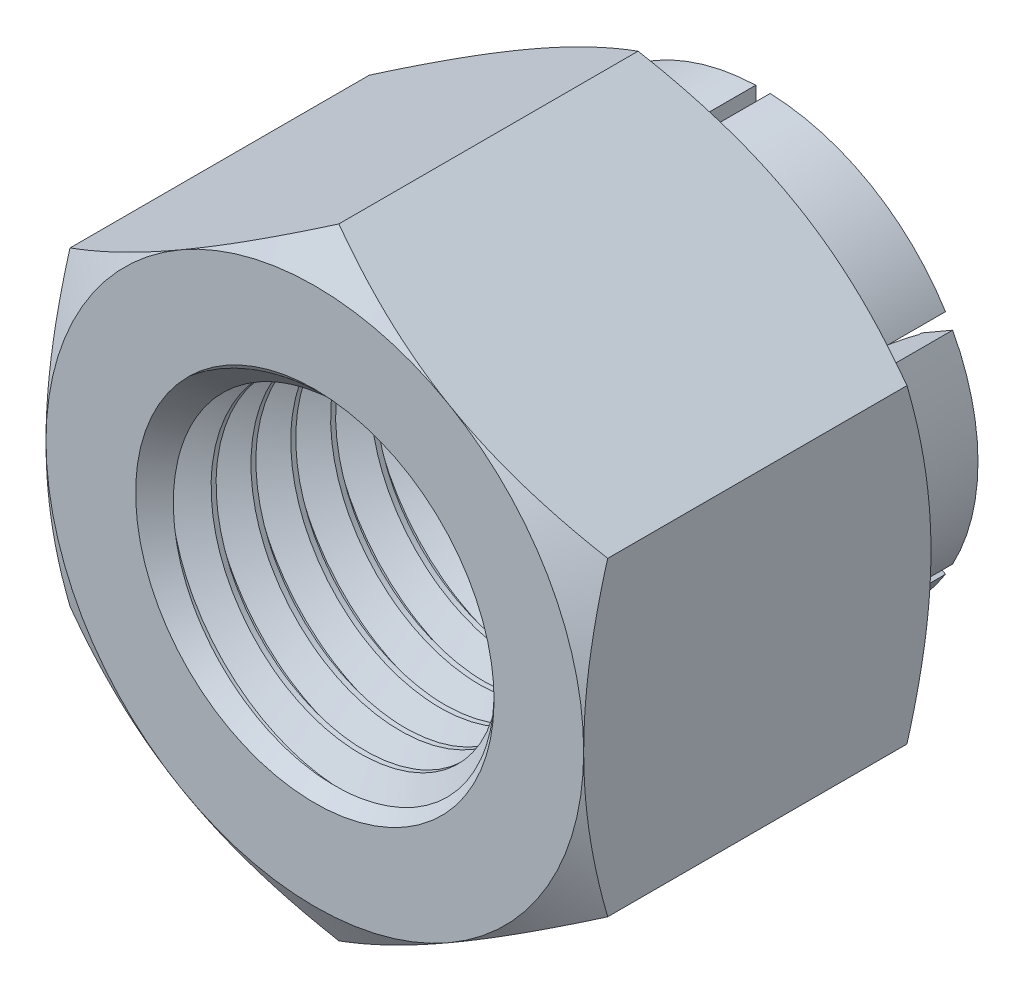
from build123d import *

# Parameters (mm, degrees)
EXTRUDE1_DEPTH          = 11.90625
SKETCH2_OUTSIDE_W       = 80.672
SKETCH2_OUTSIDE_H       = 82.882
SKETCH2_OUTSIDE_R       = 7.14375
CUT_EXTRUDE1_DEPTH      = 17.150423272
CUT_EXTRUDE1_DRAFT      = -60
SKETCH4_R               = 4.7625
CUT_EXTRUDE3_DEPTH      = 17.150423272
SKETCH12_OUTSIDE_W      = 21.26
SKETCH12_OUTSIDE_H      = 23.47
SKETCH12_OUTSIDE_R      = 5.715
CUT_EXTRUDE10_DEPTH     = 2.67890625
SKETCH15_W              = 0.381
SKETCH15_H              = 8.248891971
CUT_EXTRUDE_THIN2_DEPTH = 2.17090625
CIRPATTERN1_COUNT       = 6
SKETCH3_OUTSIDE_W       = 74.228
SKETCH3_OUTSIDE_H       = 76.438
SKETCH3_OUTSIDE_R       = 7.14375
CUT_EXTRUDE2_DEPTH      = 15.29060025
CUT_EXTRUDE2_DRAFT      = -60
SWEEP1_PITCH            = 1.058333333
CUT_EXTRUDE8_DEPTH      = 17.945996243
CUT_EXTRUDE9_DEPTH      = 17.150423346
SKETCH17_R              = 4.7725
SKETCH17_R_2            = 4.7625
BOSS_EXTRUDE1_DEPTH     = 0.1
SKETCH16_W              = 0.381
SKETCH16_H              = 8.248891971
CUT_EXTRUDE_THIN3_DEPTH = 2.17890625
CIRPATTERN14_COUNT      = 6


with BuildPart() as part:
    # Sketch1 → Extrude1 (new body)
    with BuildSketch(Plane.XY):
        Polygon((0, 8.248891971), (-7.14375, 4.124445986), (-7.14375, -4.124445986), (0, -8.248891971), (7.14375, -4.124445986), (7.14375, 4.124445986), align=None)
    extrude(amount=-EXTRUDE1_DEPTH)


with BuildPart() as cut_extrude1_tool:
    # Sketch2 outside → Cut-Extrude1 (with draft: the straight prism first)
    with BuildSketch(Plane.XY):
        Rectangle(SKETCH2_OUTSIDE_W, SKETCH2_OUTSIDE_H)
        Circle(SKETCH2_OUTSIDE_R, mode=Mode.SUBTRACT)
    extrude(amount=-CUT_EXTRUDE1_DEPTH)
    # Cut-Extrude1: the draft: its side faces are tilted about the plane it starts from
    cut_extrude1_sides = [cut_extrude1_tool.faces().sort_by_distance(p)[0] for p in [
        (0, -41.441, -8.575211636),
        (40.336, 0, -8.575211636),
        (0, 41.441, -8.575211636),
        (-40.336, 0, -8.575211636),
        (-7.14375, 0, -8.575211636),
    ]]
    draft(cut_extrude1_sides, Plane.XY, CUT_EXTRUDE1_DRAFT)


with BuildPart() as part_1:
    add(part.part)

    # Cut-Extrude1: cut by cut_extrude1_tool
    add(cut_extrude1_tool.part, mode=Mode.SUBTRACT)

    # Sketch4 → Cut-Extrude3 (cut, through all)
    with BuildSketch(Plane.XY):
        Circle(SKETCH4_R)
    extrude(amount=-CUT_EXTRUDE3_DEPTH, mode=Mode.SUBTRACT)

    # Sketch12 outside → Cut-Extrude10 (cut)
    with BuildSketch(Plane(origin=(0, 0, -11.90625), x_dir=(-1, 0, 0), z_dir=(0, 0, -1))):
        Rectangle(SKETCH12_OUTSIDE_W, SKETCH12_OUTSIDE_H)
        Circle(SKETCH12_OUTSIDE_R, mode=Mode.SUBTRACT)
    extrude(amount=-CUT_EXTRUDE10_DEPTH, mode=Mode.SUBTRACT)

    # Sketch15 → Cut-Extrude-Thin2 (cut)
    with BuildSketch(Plane(origin=(0, 0, -11.90625), x_dir=(-1, 0, 0), z_dir=(0, 0, -1))):
        with Locations((0, -4.124445986)):
            Rectangle(SKETCH15_W, SKETCH15_H)
    cut_extrude_thin2 = extrude(amount=-CUT_EXTRUDE_THIN2_DEPTH, mode=Mode.SUBTRACT)

    # CirPattern1: Cut-Extrude-Thin2 ×6 about axis
    cirpattern1_axis = Axis((0, 0, 0), (0, 0, 1))
    for i in range(1, CIRPATTERN1_COUNT):
        add(cut_extrude_thin2.rotate(cirpattern1_axis, i * 360 / CIRPATTERN1_COUNT), mode=Mode.SUBTRACT)


with BuildPart() as cut_extrude2_tool:
    # Sketch3 outside → Cut-Extrude2 (with draft: the straight prism first)
    with BuildSketch(Plane(origin=(0, 0, -9.22734375), x_dir=(-1, 0, 0), z_dir=(0, 0, -1))):
        Rectangle(SKETCH3_OUTSIDE_W, SKETCH3_OUTSIDE_H)
        Circle(SKETCH3_OUTSIDE_R, mode=Mode.SUBTRACT)
    extrude(amount=-CUT_EXTRUDE2_DEPTH)
    # Cut-Extrude2: the draft: its side faces are tilted about the plane it starts from
    cut_extrude2_sides = [cut_extrude2_tool.faces().sort_by_distance(p)[0] for p in [
        (0, -38.219, -1.582043625),
        (-37.114, 0, -1.582043625),
        (0, 38.219, -1.582043625),
        (37.114, 0, -1.582043625),
        (7.14375, 0, -1.582043625),
    ]]
    draft(cut_extrude2_sides, Plane(origin=(0, 0, -9.22734375), x_dir=(-1, 0, 0), z_dir=(0, 0, -1)), CUT_EXTRUDE2_DRAFT)


with BuildPart() as part_2:
    add(part_1.part)

    # Cut-Extrude2: cut by cut_extrude2_tool
    add(cut_extrude2_tool.part, mode=Mode.SUBTRACT)



with BuildPart() as body_2:
    # Sweep1: the profile of Sketch9 profile screwed along a right-hand helix of 12.25 turns, 6 arcs to a turn; built about Z, then put on its axis
    sweep1_z = Axis((0, 0, 0), (0, 0, 1))
    sweep1_corners = [(4.075092336, 0, -0.529166667), (4.075092336, 0, -0.396875), (4.7631, 0, 0.00034641), (4.7631, 0, -0.926388077)]
    with BuildLine(mode=Mode.PRIVATE) as sweep1_profile:
        Line(sweep1_corners[0], sweep1_corners[1])
        Line(sweep1_corners[1], sweep1_corners[2])
        Line(sweep1_corners[2], sweep1_corners[3])
        Line(sweep1_corners[3], sweep1_corners[0])
    sweep1_cap = Face(sweep1_profile.wire())
    sweep1_turn_angles = [0, 30, 60, 90, 120, 150, 180, 210, 240, 270, 300, 330, 360]
    sweep1_turn_weights = [1, 0.8660254037844387, 1, 0.8660254037844387, 1, 0.8660254037844387, 1, 0.8660254037844387, 1, 0.8660254037844387, 1, 0.8660254037844387, 1]
    sweep1_turn_rails = [Edge.make_bspline([Vector(p[0], p[1], 0).rotate(sweep1_z, sweep1_turn_angles[k]) / sweep1_turn_weights[k] + Vector(0, 0, p[2] + SWEEP1_PITCH * sweep1_turn_angles[k] / 360) for k in range(13)], [0, 0, 0, 1, 1, 2, 2, 3, 3, 4, 4, 5, 5, 6, 6, 6], 2, sweep1_turn_weights) for p in sweep1_corners]
    sweep1_turn_sides = [Face.make_surface_from_curves(sweep1_turn_rails[p[0]], sweep1_turn_rails[p[1]]) for p in [(0, 1), (1, 2), (2, 3), (3, 0)]]
    sweep1_last_angles = [4320, 4350, 4380, 4395, 4410]
    sweep1_last_weights = [1, 0.8660254037844387, 1, 0.9659258262890231, 1]
    sweep1_last_rails = [Edge.make_bspline([Vector(p[0], p[1], 0).rotate(sweep1_z, sweep1_last_angles[k]) / sweep1_last_weights[k] + Vector(0, 0, p[2] + SWEEP1_PITCH * sweep1_last_angles[k] / 360) for k in range(5)], [0, 0, 0, 1, 1, 2, 2, 2], 2, sweep1_last_weights) for p in sweep1_corners]
    sweep1_last_sides = [Face.make_surface_from_curves(sweep1_last_rails[p[0]], sweep1_last_rails[p[1]]) for p in [(0, 1), (1, 2), (2, 3), (3, 0)]]
    sweep1 = Plane(origin=(0, 0, 0), x_dir=(0, 1, 0), z_dir=(0, 0, -1)) * Solid(Shell([*[p.moved(Location((0, 0, SWEEP1_PITCH * i))) for i in range(12) for p in sweep1_turn_sides], *sweep1_last_sides, sweep1_cap, sweep1_cap.rotate(sweep1_z, 4410).moved(Location((0, 0, SWEEP1_PITCH * 4410 / 360)))]))
    add(sweep1)

    # Sketch10 → Cut-Extrude8 (cut, through all)
    with BuildSketch(Plane.XY):
        Polygon((0, 8.248891971), (-7.14375, 4.124445986), (-7.14375, -4.124445986), (0, -8.248891971), (7.14375, -4.124445986), (7.14375, 4.124445986), align=None)
    extrude(amount=CUT_EXTRUDE8_DEPTH, mode=Mode.SUBTRACT)

    # Sketch11 → Cut-Extrude9 (cut, through all)
    with BuildSketch(Plane(origin=(0, 0, -11.90625), x_dir=(-1, 0, 0), z_dir=(0, 0, -1))):
        Polygon((7.14375, 4.124445986), (0, 8.248891971), (-7.14375, 4.124445986), (-7.14375, -4.124445986), (0, -8.248891971), (7.14375, -4.124445986), align=None)
    extrude(amount=CUT_EXTRUDE9_DEPTH, mode=Mode.SUBTRACT)

    # Cut-Extrude6 cone 1 section (through the dimple's axis) → Cut-Extrude6 (revolve, cut)
    with BuildSketch(Plane(origin=(0, 0, 0), x_dir=(0, -1, 0), z_dir=(1, 0, 0))):
        Polygon((0, 0), (4.7625, 0), (0, 4.7625), align=None)
    revolve(axis=Axis((0, 0, 0), (0, 0, -1)), mode=Mode.SUBTRACT)

    # Cut-Extrude7 cone 1 section (through the dimple's axis) → Cut-Extrude7 (revolve, cut)
    with BuildSketch(Plane(origin=(0, 0, -11.90625), x_dir=(0, 1, 0), z_dir=(1, 0, 0))):
        Polygon((0, 0), (4.7625, 0), (0, 4.7625), align=None)
    revolve(axis=Axis((0, 0, -11.90625), (0, 0, 1)), mode=Mode.SUBTRACT)


with BuildPart() as part_3:
    add(part_2.part)

    add(body_2.part)  # Boss-Extrude1 merges body 2
    # Sketch17 → Boss-Extrude1 (add)
    with BuildSketch(Plane.XY):
        Circle(SKETCH17_R)
        Circle(SKETCH17_R_2, mode=Mode.SUBTRACT)
    extrude(amount=-BOSS_EXTRUDE1_DEPTH)

    # Sketch16 → Cut-Extrude-Thin3 (cut)
    with BuildSketch(Plane(origin=(0, 0, -11.90625), x_dir=(-1, 0, 0), z_dir=(0, 0, -1))):
        with Locations((0, -4.124445986)):
            Rectangle(SKETCH16_W, SKETCH16_H)
    cut_extrude_thin3 = extrude(amount=-CUT_EXTRUDE_THIN3_DEPTH, mode=Mode.SUBTRACT)

    # CirPattern14: Cut-Extrude-Thin3 ×6 about axis
    cirpattern14_axis = Axis((0, 0, 0), (0, 0, -1))
    for i in range(1, CIRPATTERN14_COUNT):
        add(cut_extrude_thin3.rotate(cirpattern14_axis, i * 360 / CIRPATTERN14_COUNT), mode=Mode.SUBTRACT)


solid = part_3.part
